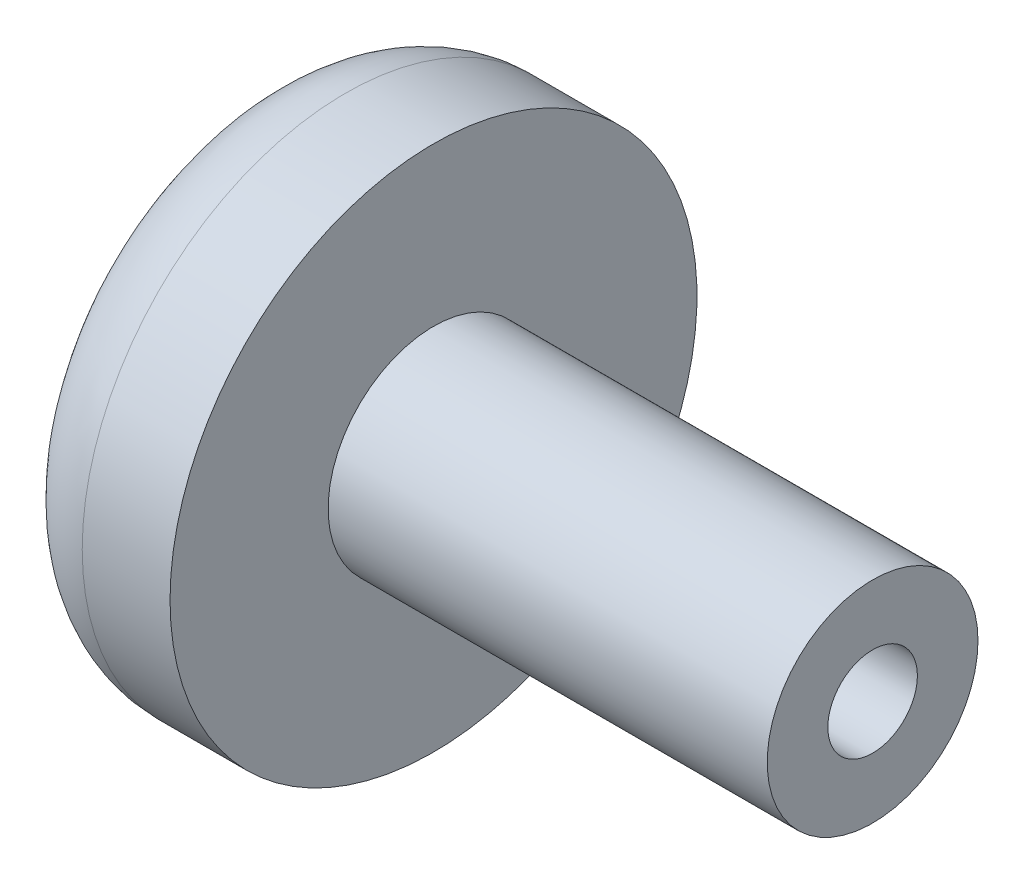
from build123d import *

# Parameters (mm, degrees)
SKETCH1_R           = 7.62
SKETCH1_R_2         = 3.2385
BOSS_EXTRUDE1_DEPTH = 31.75
SKETCH2_R           = 1.651
CUT_EXTRUDE1_DEPTH  = 11.684
SKETCH4_R           = 19.05
BOSS_EXTRUDE2_DEPTH = 12.7
FILLET1_R           = 6.35
THREAD1_PITCH       = 0.7


with BuildPart() as part:
    # Sketch1 → Boss-Extrude1 (new body)
    with BuildSketch(Plane(origin=(0, 0, 0), x_dir=(0, 0, -1), z_dir=(1, 0, 0))):
        Circle(SKETCH1_R)
        Circle(SKETCH1_R_2, mode=Mode.SUBTRACT)
    extrude(amount=BOSS_EXTRUDE1_DEPTH)

    # Sketch2 → Cut-Extrude1 (cut)
    with BuildSketch(Plane.XY):
        with Locations((15.875, 0)):
            Circle(SKETCH2_R)
    extrude(amount=-CUT_EXTRUDE1_DEPTH, mode=Mode.SUBTRACT)

    # Sketch4 → Boss-Extrude2 (add)
    with BuildSketch(Plane.ZY):
        Circle(SKETCH4_R)
    extrude(amount=BOSS_EXTRUDE2_DEPTH)

    # Fillet1
    fillet1_edges = [part.edges().sort_by_distance(p)[0] for p in [
        (-12.7, 0, -19.05),
    ]]
    fillet(fillet1_edges, radius=FILLET1_R)

    # Thread1: the profile of Thread Profile1 profile screwed along a right-hand helix of 14.285714 turns, 6 arcs to a turn; built about Z, then put on its axis
    thread1_z = Axis((0, 0, 0), (0, 0, 1))
    thread1_corners = [(1.6507, 0, -0.000173205), (2.029886112, 0, 0.218749999), (2.029886112, 0, 0.306249999), (1.6507, 0, 0.525173203)]
    with BuildLine(mode=Mode.PRIVATE) as thread1_profile:
        Line(thread1_corners[0], thread1_corners[1])
        Line(thread1_corners[1], thread1_corners[2])
        Line(thread1_corners[2], thread1_corners[3])
        Line(thread1_corners[3], thread1_corners[0])
    thread1_cap = Face(thread1_profile.wire())
    thread1_turn_angles = [0, 30, 60, 90, 120, 150, 180, 210, 240, 270, 300, 330, 360]
    thread1_turn_weights = [1, 0.8660254037844387, 1, 0.8660254037844387, 1, 0.8660254037844387, 1, 0.8660254037844387, 1, 0.8660254037844387, 1, 0.8660254037844387, 1]
    thread1_turn_rails = [Edge.make_bspline([Vector(p[0], p[1], 0).rotate(thread1_z, thread1_turn_angles[k]) / thread1_turn_weights[k] + Vector(0, 0, p[2] + THREAD1_PITCH * thread1_turn_angles[k] / 360) for k in range(13)], [0, 0, 0, 1, 1, 2, 2, 3, 3, 4, 4, 5, 5, 6, 6, 6], 2, thread1_turn_weights) for p in thread1_corners]
    thread1_turn_sides = [Face.make_surface_from_curves(thread1_turn_rails[p[0]], thread1_turn_rails[p[1]]) for p in [(0, 1), (1, 2), (2, 3), (3, 0)]]
    thread1_last_angles = [5040, 5070, 5100, 5121.428571429, 5142.857142857]
    thread1_last_weights = [1, 0.8660254037844387, 1, 0.9308737486442035, 1]
    thread1_last_rails = [Edge.make_bspline([Vector(p[0], p[1], 0).rotate(thread1_z, thread1_last_angles[k]) / thread1_last_weights[k] + Vector(0, 0, p[2] + THREAD1_PITCH * thread1_last_angles[k] / 360) for k in range(5)], [0, 0, 0, 1, 1, 2, 2, 2], 2, thread1_last_weights) for p in thread1_corners]
    thread1_last_sides = [Face.make_surface_from_curves(thread1_last_rails[p[0]], thread1_last_rails[p[1]]) for p in [(0, 1), (1, 2), (2, 3), (3, 0)]]
    thread1 = Plane(origin=(15.875, 0, -11.16), x_dir=(1, 0, 0), z_dir=(0, 0, 1)) * Solid(Shell([*[p.moved(Location((0, 0, THREAD1_PITCH * i))) for i in range(14) for p in thread1_turn_sides], *thread1_last_sides, thread1_cap, thread1_cap.rotate(thread1_z, 5142.857142857).moved(Location((0, 0, THREAD1_PITCH * 5142.857142857 / 360)))]))
    add(thread1, mode=Mode.SUBTRACT)


solid = part.part
